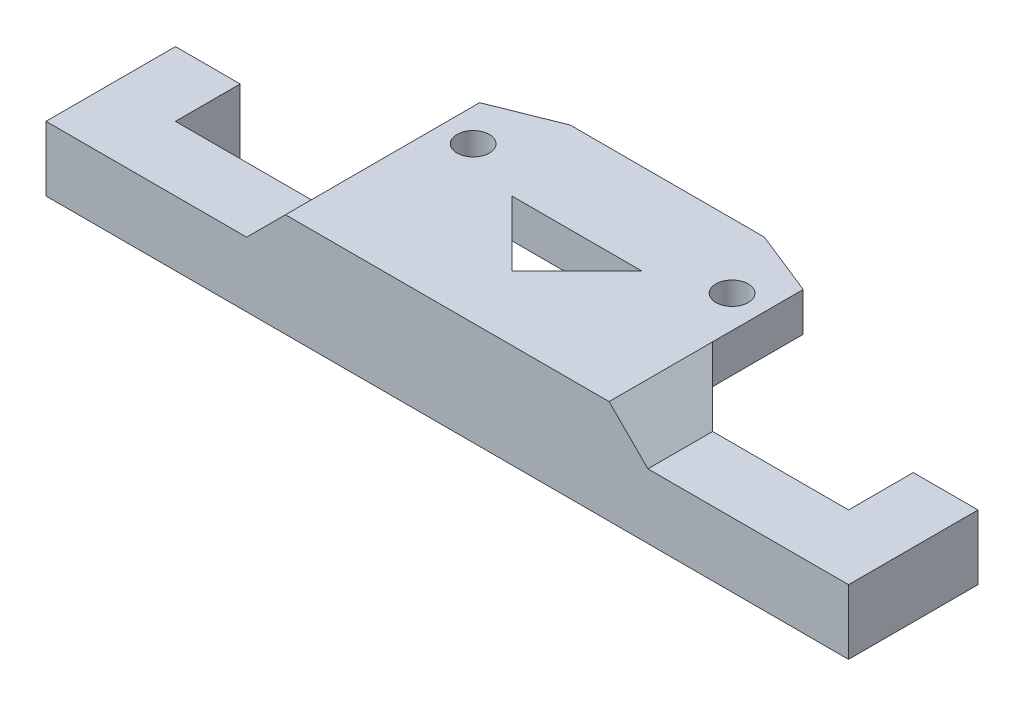
from build123d import *
from build123d.topology import SkipClean

# Parameters (mm, degrees)
BOSS_EXTRUDE1_DEPTH  = 5
SKETCH2_R            = 1.25
BOSS_EXTRUDE2_DEPTH  = 3
CHAMFER1_SIZE        = 3
CHAMFER2_START       = 5
CHAMFER2_DEPTH       = 3
CHAMFER2_START_2     = 15.831335157
CHAMFER2_2_OUTLINE_W = 23.160042872
CHAMFER2_2_OUTLINE_H = 4
CHAMFER2_2_DEPTH     = 3.168664843
CHAMFER2_START_3     = -6.08897506
CHAMFER2_3_OUTLINE_W = 3.839957128
CHAMFER2_3_OUTLINE_H = 4
CHAMFER2_3_DEPTH     = 19.798989873


with BuildPart() as part:
    # Sketch1 → Boss-Extrude1 (new body)
    with BuildSketch(Plane(origin=(0, 0, 0), x_dir=(1, 0, 0), z_dir=(0, 1, 0))):
        Polygon((-24.111111111, 5), (-24.111111111, 0), (27.888888889, 0), (27.888888889, 5), (32.888888889, 5), (32.888888889, -5), (-29.111111111, -5), (-29.111111111, 5), align=None)
    extrude(amount=BOSS_EXTRUDE1_DEPTH)

    # Sketch2 → Boss-Extrude2 (add)
    with BuildSketch(Plane(origin=(0, 5, 0), x_dir=(1, 0, 0), z_dir=(0, 1, 0))):
        Polygon((-10.611111111, -5), (-10.611111111, 10), (-5.611111111, 12), (9.388888889, 12), (14.388888889, 10), (14.388888889, -5), align=None)
        with Locations(Location((-8.111111111, 7, 0), (0, 0, 270))):
            Circle(SKETCH2_R, mode=Mode.SUBTRACT)
        with Locations(Location((11.888888889, 7, 0), (0, 0, 270))):
            Circle(SKETCH2_R, mode=Mode.SUBTRACT)
        Polygon((1.888888889, 0), (-3.111111111, 5), (6.888888889, 5), align=None, mode=Mode.SUBTRACT)
    extrude(amount=BOSS_EXTRUDE2_DEPTH)

    # Chamfer1
    chamfer1_edges = [part.edges().sort_by_distance(p)[0] for p in [
        (14.388888889, 5, 2.5),
        (-10.611111111, 5, 2.5),
    ]]
    chamfer(chamfer1_edges, length=CHAMFER1_SIZE - 0.0001)  # a hair under: the kernel refuses the full size

    # Chamfer2: read off the stored shape, not the designer's step
    # Chamfer2 outline → Chamfer2 (add)
    with BuildSketch(Plane(origin=(0, 0, 0), x_dir=(1, 0, 0), z_dir=(0, 1, 0)).offset(CHAMFER2_START)):
        Polygon((-13.611111111, 0), (-10.611111111, 0), (-10.611111111, 3), align=None)
        Polygon((17.388888889, 0), (14.388888889, 3), (14.388888889, 0), align=None)
    extrude(amount=CHAMFER2_DEPTH)

    # Chamfer2 2 outline → Chamfer2 2 (cut)
    with SkipClean():  # the faces are left unmerged after this step: merging them gives an invalid solid
        with BuildSketch(Plane(origin=(0, 0, 0), x_dir=(0.7071067811865513, -0.7071067811865437, 0), z_dir=(0.7071067811865436, 0.7071067811865516, 0)).offset(CHAMFER2_START_2)):
            with Locations((-1.580021436, 2)):
                Rectangle(CHAMFER2_2_OUTLINE_W, CHAMFER2_2_OUTLINE_H)
        extrude(amount=CHAMFER2_2_DEPTH, mode=Mode.SUBTRACT)

    # Chamfer2 3 outline → Chamfer2 3 (cut)
    with SkipClean():  # the faces are left unmerged after this step: merging them gives an invalid solid
        with BuildSketch(Plane(origin=(0, 0, 0), x_dir=(0.7071067811865513, -0.7071067811865437, 0), z_dir=(0.7071067811865436, 0.7071067811865516, 0)).offset(CHAMFER2_START_3)):
            with Locations((-15.080021436, 2)):
                Rectangle(CHAMFER2_3_OUTLINE_W, CHAMFER2_3_OUTLINE_H)
        extrude(amount=CHAMFER2_3_DEPTH, mode=Mode.SUBTRACT)


solid = part.part
